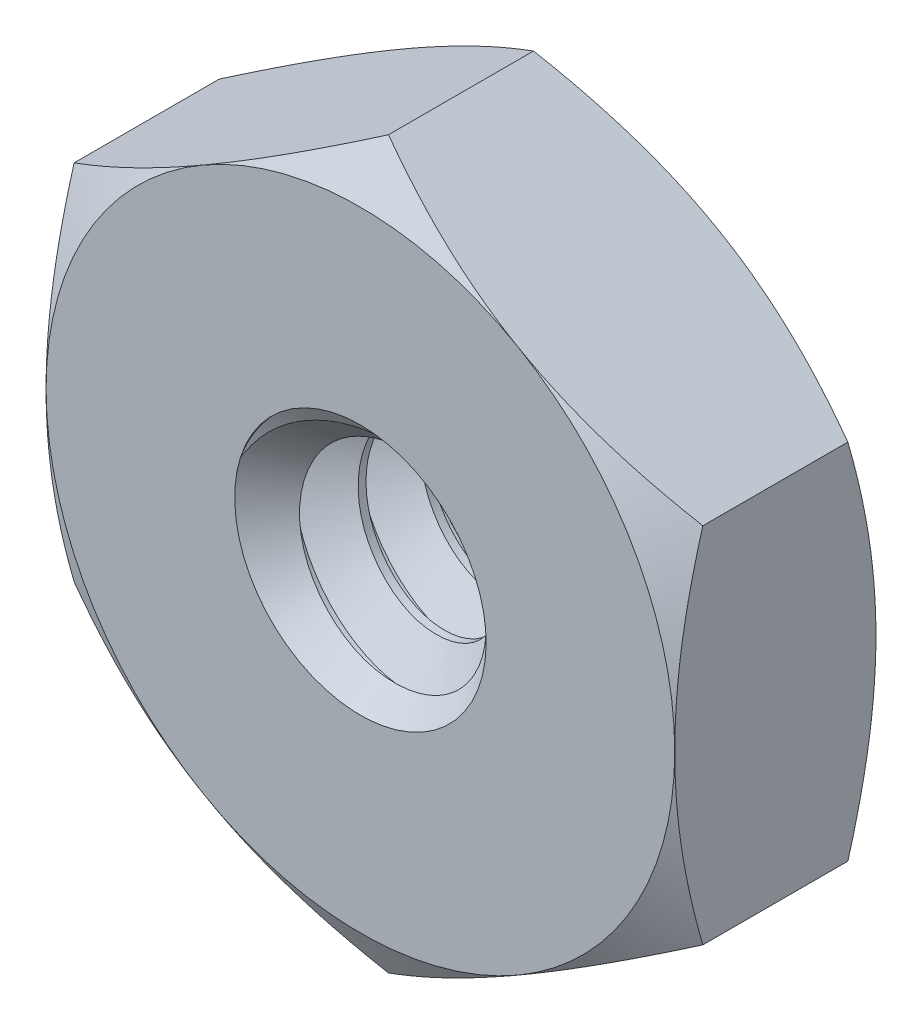
from build123d import *

# Parameters (mm, degrees)
EXTRUDE1_DEPTH          = 0.4
SKETCH13_R              = 0.5
BOSS_EXTRUDE1_DEPTH     = 0.8
CUT_SWEEP1_PITCH        = 0.25
SKETCH7_OUTSIDE_W       = 93.268
SKETCH7_OUTSIDE_H       = 93.654
SKETCH7_OUTSIDE_R       = 1.25
EXTRUDE2_DEPTH          = 25.4
EXTRUDE2_DRAFT          = -60
MIRROR2_COPY_1_SKETCH_W = 93.268
MIRROR2_COPY_1_SKETCH_H = 93.654
MIRROR2_COPY_1_SKETCH_R = 1.25
MIRROR2_COPY_1_DEPTH    = 25.4
MIRROR2_COPY_1_DRAFT    = -60


with BuildPart() as part:
    # Sketch1 → Extrude1 (new, symmetric)
    with BuildSketch(Plane.XY):
        Polygon((-1.25, 0.721687836), (-1.25, -0.721687836), (0, -1.443375673), (1.25, -0.721687836), (1.25, 0.721687836), (0, 1.443375673), align=None)
    extrude(amount=EXTRUDE1_DEPTH, both=True)

    # Cut-Extrude2 cone 1 section (through the dimple's axis) → Cut-Extrude2 (revolve, cut)
    with BuildSketch(Plane(origin=(0, 0, 0.4), x_dir=(0, -1, 0), z_dir=(1, 0, 0))):
        Polygon((0, 0), (0.5, 0), (0, 0.5), align=None)
    revolve(axis=Axis((0, 0, 0.4), (0, 0, -1)), mode=Mode.SUBTRACT)

    # Cut-Extrude3 cone 1 section (through the dimple's axis) → Cut-Extrude3 (revolve, cut)
    with BuildSketch(Plane(origin=(0, 0, -0.4), x_dir=(0, 1, 0), z_dir=(1, 0, 0))):
        Polygon((0, 0), (0.5, 0), (0, 0.5), align=None)
    revolve(axis=Axis((0, 0, -0.4), (0, 0, 1)), mode=Mode.SUBTRACT)


with BuildPart() as body_2:
    # Sketch13 → Boss-Extrude1 (new body)
    with BuildSketch(Plane(origin=(0, 0, -0.4), x_dir=(-1, 0, 0), z_dir=(0, 0, -1))):
        Circle(SKETCH13_R)
    extrude(amount=-BOSS_EXTRUDE1_DEPTH)

    # Cut-Sweep1: arcs per turn and ends read off the stored shape
    # Cut-Sweep1: the profile of Sketch12 profile screwed along a right-hand helix through 5 turns, 6 arcs to a turn; built about Z, then put on its axis
    cut_sweep1_z = Axis((0, 0, 0), (0, 0, 1))
    cut_sweep1_corners = [(0.5003, 0, -0.468923205), (0.5003, 0, -0.249826795), (0.337620237, 0, -0.34375), (0.337620237, 0, -0.375)]
    with BuildLine(mode=Mode.PRIVATE) as cut_sweep1_profile:
        Line(cut_sweep1_corners[0], cut_sweep1_corners[1])
        Line(cut_sweep1_corners[1], cut_sweep1_corners[2])
        Line(cut_sweep1_corners[2], cut_sweep1_corners[3])
        Line(cut_sweep1_corners[3], cut_sweep1_corners[0])
    cut_sweep1_cap = Face(cut_sweep1_profile.wire())
    cut_sweep1_turn_angles = [0, 30, 60, 90, 120, 150, 180, 210, 240, 270, 300, 330, 360]
    cut_sweep1_turn_weights = [1, 0.8660254037844387, 1, 0.8660254037844387, 1, 0.8660254037844387, 1, 0.8660254037844387, 1, 0.8660254037844387, 1, 0.8660254037844387, 1]
    cut_sweep1_turn_rails = [Edge.make_bspline([Vector(p[0], p[1], 0).rotate(cut_sweep1_z, cut_sweep1_turn_angles[k]) / cut_sweep1_turn_weights[k] + Vector(0, 0, p[2] + CUT_SWEEP1_PITCH * cut_sweep1_turn_angles[k] / 360) for k in range(13)], [0, 0, 0, 1, 1, 2, 2, 3, 3, 4, 4, 5, 5, 6, 6, 6], 2, cut_sweep1_turn_weights) for p in cut_sweep1_corners]
    cut_sweep1_turn_sides = [Face.make_surface_from_curves(cut_sweep1_turn_rails[p[0]], cut_sweep1_turn_rails[p[1]]) for p in [(0, 1), (1, 2), (2, 3), (3, 0)]]
    cut_sweep1 = Plane(origin=(0, 0, -0.4), x_dir=(0, 1, 0), z_dir=(0, 0, 1)) * Solid(Shell([*[p.moved(Location((0, 0, CUT_SWEEP1_PITCH * i))) for i in range(5) for p in cut_sweep1_turn_sides], cut_sweep1_cap, cut_sweep1_cap.rotate(cut_sweep1_z, 1800).moved(Location((0, 0, CUT_SWEEP1_PITCH * 1800 / 360)))]))
    add(cut_sweep1, mode=Mode.SUBTRACT)


with BuildPart() as part_1:
    add(part.part)

    # Combine1: cut body 2
    add(body_2.part, mode=Mode.SUBTRACT)


with BuildPart() as extrude2_tool:
    # Sketch7 outside → Extrude2 (with draft: the straight prism first)
    with BuildSketch(Plane.XY.offset(0.4)):
        Rectangle(SKETCH7_OUTSIDE_W, SKETCH7_OUTSIDE_H)
        Circle(SKETCH7_OUTSIDE_R, mode=Mode.SUBTRACT)
    extrude(amount=-EXTRUDE2_DEPTH)
    # Extrude2: the draft: its side faces are tilted about the plane it starts from
    extrude2_sides = [extrude2_tool.faces().sort_by_distance(p)[0] for p in [
        (0, -46.827, -12.3),
        (46.634, 0, -12.3),
        (0, 46.827, -12.3),
        (-46.634, 0, -12.3),
        (-1.25, 0, -12.3),
    ]]
    draft(extrude2_sides, Plane.XY.offset(0.4), EXTRUDE2_DRAFT)


with BuildPart() as part_2:
    add(part_1.part)

    # Extrude2: cut by extrude2_tool
    add(extrude2_tool.part, mode=Mode.SUBTRACT)


with BuildPart() as mirror2_copy_1_tool:
    # Mirror2 copy 1 sketch → Mirror2 copy 1 (with draft: the straight prism first)
    with BuildSketch(Plane(origin=(0, 0, -0.4), x_dir=(1, 0, 0), z_dir=(0, 0, -1))):
        Rectangle(MIRROR2_COPY_1_SKETCH_W, MIRROR2_COPY_1_SKETCH_H)
        Circle(MIRROR2_COPY_1_SKETCH_R, mode=Mode.SUBTRACT)
    extrude(amount=-MIRROR2_COPY_1_DEPTH)
    # Mirror2 copy 1: the draft: its side faces are tilted about the plane it starts from
    mirror2_copy_1_sides = [mirror2_copy_1_tool.faces().sort_by_distance(p)[0] for p in [
        (0, -46.827, 12.3),
        (46.634, 0, 12.3),
        (0, 46.827, 12.3),
        (-46.634, 0, 12.3),
        (-1.25, 0, 12.3),
    ]]
    draft(mirror2_copy_1_sides, Plane(origin=(0, 0, -0.4), x_dir=(1, 0, 0), z_dir=(0, 0, -1)), MIRROR2_COPY_1_DRAFT)


with BuildPart() as part_3:
    add(part_2.part)

    # Mirror2 copy 1: cut by mirror2_copy_1_tool
    add(mirror2_copy_1_tool.part, mode=Mode.SUBTRACT)


solid = part_3.part
